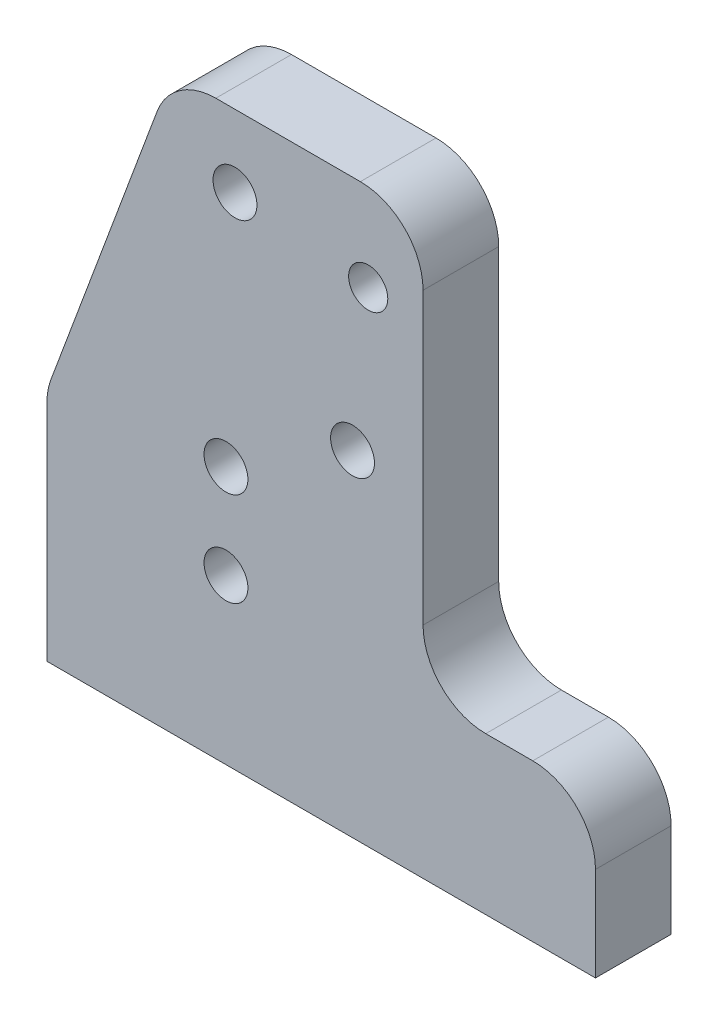
from build123d import *

# Parameters (mm, degrees)
BOSS_EXTRUDE1_DEPTH       = 4.826
M3X0_5_TAPPED_HOLE2_D     = 2.8
M3X0_5_TAPPED_HOLE3_D     = 2.5
M3X0_5_TAPPED_HOLE3_DEPTH = 5
M3X0_5_TAPPED_HOLE3_TIP   = 0.751075774
FILLET2_R                 = 4
CUT_EXTRUDE1_DEPTH        = 10
SKETCH23_R                = 1.25
CUT_EXTRUDE2_DEPTH        = 50.732185514
SKETCH27_W                = 35
SKETCH27_H                = 4.826
SKETCH27_R                = 1.25
BOSS_EXTRUDE2_DEPTH       = 1.5
SKETCH28_R                = 1.4
CUT_EXTRUDE3_DEPTH        = 50.732185514


with BuildPart() as part:
    # Sketch1 → Boss-Extrude1 (new body)
    with BuildSketch(Plane.XY):
        Polygon((0, 13.5), (0, 0), (35, 0), (35, 8.5), (24, 8.5), (24, 35), (8, 35), align=None)
    extrude(amount=BOSS_EXTRUDE1_DEPTH)

    # M3x0.5 Tapped Hole2 (through all)
    with Locations(Plane.XY.offset(4.826)):
        with Locations((12, 30.4)):
            Hole(M3X0_5_TAPPED_HOLE2_D / 2)

    # M3x0.5 Tapped Hole3
    with Locations(Plane(origin=(0, 0, 0), x_dir=(-1, 0, 0), z_dir=(0, -1, 0))):
        with Locations((-16.73, -2.413), (-28.73, -2.413)):
            Hole(M3X0_5_TAPPED_HOLE3_D / 2, depth=M3X0_5_TAPPED_HOLE3_DEPTH)
            with Locations((0, 0, -(M3X0_5_TAPPED_HOLE3_DEPTH + M3X0_5_TAPPED_HOLE3_TIP / 2))):  # 118° drill point
                Cone(0, M3X0_5_TAPPED_HOLE3_D / 2, M3X0_5_TAPPED_HOLE3_TIP, mode=Mode.SUBTRACT)

    # Fillet2
    fillet2_edges = [part.edges().sort_by_distance(p)[0] for p in [
        (35, 8.5, 2.413),
        (24, 8.5, 2.413),
        (24, 35, 2.413),
        (0, 13.5, 2.413),
        (8, 35, 2.413),
    ]]
    fillet(fillet2_edges, radius=FILLET2_R)

    # Sketch19 → Cut-Extrude1 (cut)
    with BuildSketch(Plane.XY.offset(4.826)):
        with BuildLine():
            ThreePointArc((18.1, 19.9), (19.5, 18.5), (20.9, 19.9))
            ThreePointArc((20.9, 19.9), (19.5, 21.3), (18.1, 19.9))
        make_face()
    extrude(amount=-CUT_EXTRUDE1_DEPTH, mode=Mode.SUBTRACT)

    # Sketch23 → Cut-Extrude2 (cut, through all)
    with BuildSketch(Plane.XY.offset(4.826)):
        with Locations((20.5, 29.4)):
            Circle(SKETCH23_R)
    extrude(amount=-CUT_EXTRUDE2_DEPTH, mode=Mode.SUBTRACT)

    # Sketch27 → Boss-Extrude2 (add)
    with BuildSketch(Plane.XZ):
        with Locations((17.5, 2.413)):
            Rectangle(SKETCH27_W, SKETCH27_H)
        with Locations((16.73, 2.413)):
            Circle(SKETCH27_R, mode=Mode.SUBTRACT)
        with Locations((28.73, 2.413)):
            Circle(SKETCH27_R, mode=Mode.SUBTRACT)
    extrude(amount=BOSS_EXTRUDE2_DEPTH)

    # Sketch28 → Cut-Extrude3 (cut, through all)
    with BuildSketch(Plane.XY.offset(4.826)):
        with Locations((11.425, 14.96)):
            Circle(SKETCH28_R)
        with Locations((11.425, 8.96)):
            Circle(SKETCH28_R)
    extrude(amount=-CUT_EXTRUDE3_DEPTH, mode=Mode.SUBTRACT)


solid = part.part
